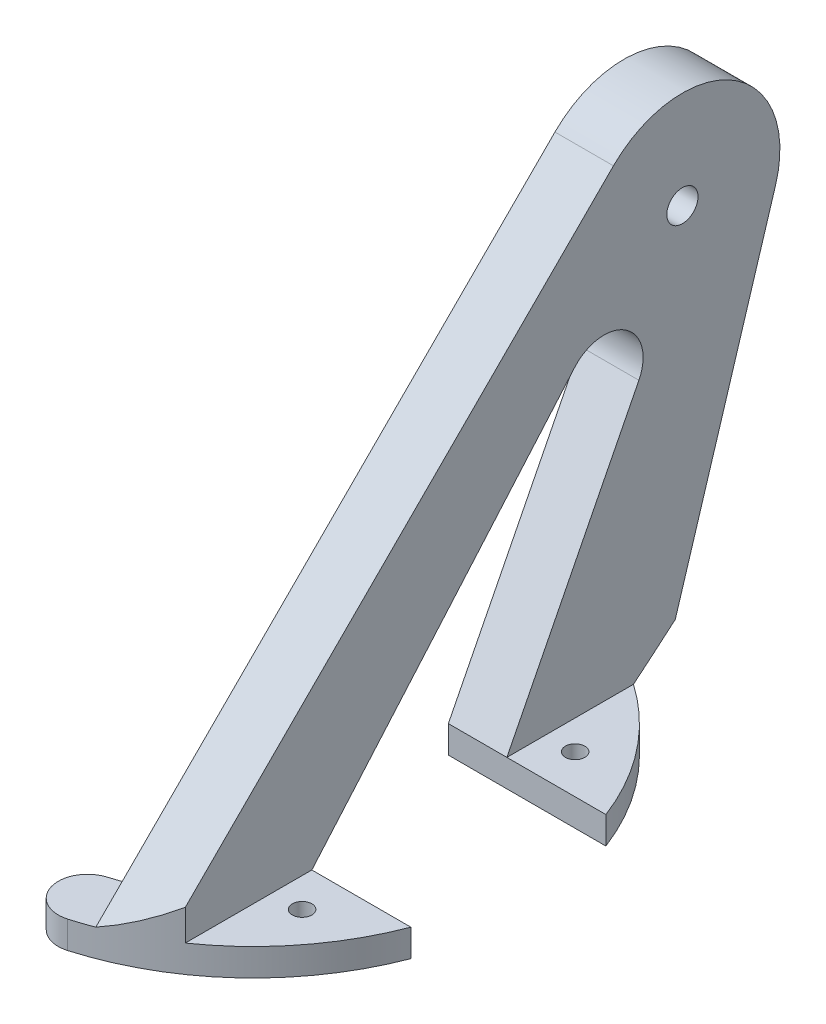
from build123d import *

# Parameters (mm, degrees)
BOSS_EXTRUDE1_DEPTH   = 7
BOSS_EXTRUDE1_2_DEPTH = 7
BOSS_EXTRUDE2_DEPTH   = 15
CUT_EXTRUDE2_START    = 10
SKETCH3_R             = 92.486171345
SKETCH3_R_2           = 70
CUT_EXTRUDE2_DEPTH    = 10
CHAMFER2_SIZE         = 10
SKETCH4_R             = 4
CUT_EXTRUDE3_DEPTH    = 163.113620009
SKETCH5_R             = 11
CUT_EXTRUDE4_DEPTH    = 5
SKETCH6_R             = 2.5
CUT_EXTRUDE5_DEPTH    = 171.073513517
BOSS_EXTRUDE3_DEPTH   = 7


with BuildPart() as part:
    # Sketch1 → Boss-Extrude1 (new body)
    with BuildSketch(Plane(origin=(0, 0, 0), x_dir=(1, 0, 0), z_dir=(0, 1, 0))):
        with BuildLine():
            ThreePointArc((65.383484153, 25), (49.497474683, 49.497474683), (25, 65.383484153))
            Line((25, 65.383484153), (25, 25))
            Line((25, 25), (65.383484153, 25))
        make_face()
    extrude(amount=-BOSS_EXTRUDE1_DEPTH)



with BuildPart() as body_2:
    # Sketch1 → Boss-Extrude1 2 (new body)
    with BuildSketch(Plane(origin=(0, 0, 0), x_dir=(1, 0, 0), z_dir=(0, 1, 0))):
        with BuildLine():
            Line((25, -25), (25, -65.383484153))
            ThreePointArc((25, -65.383484153), (49.497474683, -49.497474683), (65.383484153, -25))
            Line((65.383484153, -25), (25, -25))
        make_face()
    extrude(amount=-BOSS_EXTRUDE1_2_DEPTH)


with BuildPart() as part_1:
    add(part.part)

    add(body_2.part)  # Boss-Extrude2 merges body 2
    # Sketch2 → Boss-Extrude2 (add)
    with BuildSketch(Plane.ZY.offset(-25)):
        with BuildLine():
            Line((-65.383484153, 0), (-93.894188194, 92.646921016))
            ThreePointArc((-93.894188194, 92.646921016), (-82.896855971, 121.416608183), (-52.324444318, 117.679783125))
            Line((-52.324444318, 117.679783125), (65.383484153, 0))
            Line((65.383484153, 0), (25, 0))
            Line((25, 0), (-42.366125313, 77.869487777))
            ThreePointArc((-42.366125313, 77.869487777), (-55.501453858, 79.630239272), (-58.849166194, 66.807216074))
            Line((-58.849166194, 66.807216074), (-25, 0))
            Line((-25, 0), (-65.383484153, 0))
        make_face()
    extrude(amount=-BOSS_EXTRUDE2_DEPTH)

    # Sketch3 → Cut-Extrude2 (cut)
    with BuildSketch(Plane(origin=(0, 0, 0), x_dir=(1, 0, 0), z_dir=(0, 1, 0)).offset(CUT_EXTRUDE2_START)):
        Circle(SKETCH3_R)
        Circle(SKETCH3_R_2, mode=Mode.SUBTRACT)
    extrude(amount=-CUT_EXTRUDE2_DEPTH, mode=Mode.SUBTRACT)

    # Chamfer2
    # the kernel refuses this chamfer: 10 mm, written as the material it adds along each edge
    with BuildSketch(Plane(origin=(0, 10, 0), x_dir=(0.8280566024533268, 0, -0.5606445069145448), z_dir=(0.5606445069145448, 0, 0.8280566024533268))) as chamfer2_piece_1_section:
        Polygon((70 + CHAMFER2_SIZE, 0), (70, -CHAMFER2_SIZE), (70, 0), align=None)
    chamfer2_piece_1 = revolve(axis=Axis((0, 10, 0), (0, 1, 0)), revolution_arc=56.024500162, mode=Mode.PRIVATE)
    chamfer2_piece_1 = split(chamfer2_piece_1, bisect_by=Plane(origin=(33.827146268, 0, -63.755868056), z_dir=(0, 1, 0)), keep=Keep.TOP, mode=Mode.PRIVATE)
    chamfer2_piece_1 = split(chamfer2_piece_1, bisect_by=Plane(origin=(40, 6.324094296, -63.755868056), z_dir=(-1, 0, 0)), keep=Keep.TOP, mode=Mode.PRIVATE)
    chamfer2_piece_1 = split(chamfer2_piece_1, bisect_by=Plane(origin=(33.827146268, 5.319462172, -67.020469063), z_dir=(0, 0.2941231593783912, 0.9557675277583318)), keep=Keep.TOP, mode=Mode.PRIVATE)
    chamfer2_piece_1 = split(chamfer2_piece_1, bisect_by=Plane(origin=(25, 6.324094296, -63.755868056), z_dir=(1, 0, 0)), keep=Keep.TOP, mode=Mode.PRIVATE)
    add(chamfer2_piece_1)

    # Sketch4 → Cut-Extrude3 (cut, through all)
    with BuildSketch(Plane.ZY.offset(-25)):
        with Locations((-70, 100)):
            Circle(SKETCH4_R)
    extrude(amount=-CUT_EXTRUDE3_DEPTH, mode=Mode.SUBTRACT)

    # Sketch5 → Cut-Extrude4 (cut)
    with BuildSketch(Plane.ZY.offset(-25)):
        with Locations((-70, 100)):
            Circle(SKETCH5_R)
    extrude(amount=-CUT_EXTRUDE4_DEPTH, mode=Mode.SUBTRACT)

    # Sketch6 → Cut-Extrude5 (cut, through all)
    with BuildSketch(Plane(origin=(0, 0, 0), x_dir=(1, 0, 0), z_dir=(0, 1, 0))):
        with Locations(Location((47.5, 35, 0), (0, 0, 270))):
            Circle(SKETCH6_R)
        with Locations(Location((47.5, -35, 0), (0, 0, 270))):
            Circle(SKETCH6_R)
    extrude(amount=-CUT_EXTRUDE5_DEPTH, mode=Mode.SUBTRACT)

    # Sketch7 → Boss-Extrude3 (add)
    with BuildSketch(Plane(origin=(0, 0, 0), x_dir=(1, 0, 0), z_dir=(0, 1, 0))):
        with BuildLine():
            Line((25, -65.383484153), (25.1277486, -48.924393203))
            ThreePointArc((25.1277486, -48.924393203), (20.356318028, -51.094229775), (15.4, -52.8))
            ThreePointArc((15.4, -52.8), (10.3, -62.1), (19.6, -67.2))
            ThreePointArc((19.6, -67.2), (22.318488579, -66.346703517), (25, -65.383484153))
        make_face()
    extrude(amount=-BOSS_EXTRUDE3_DEPTH)


solid = part_1.part
